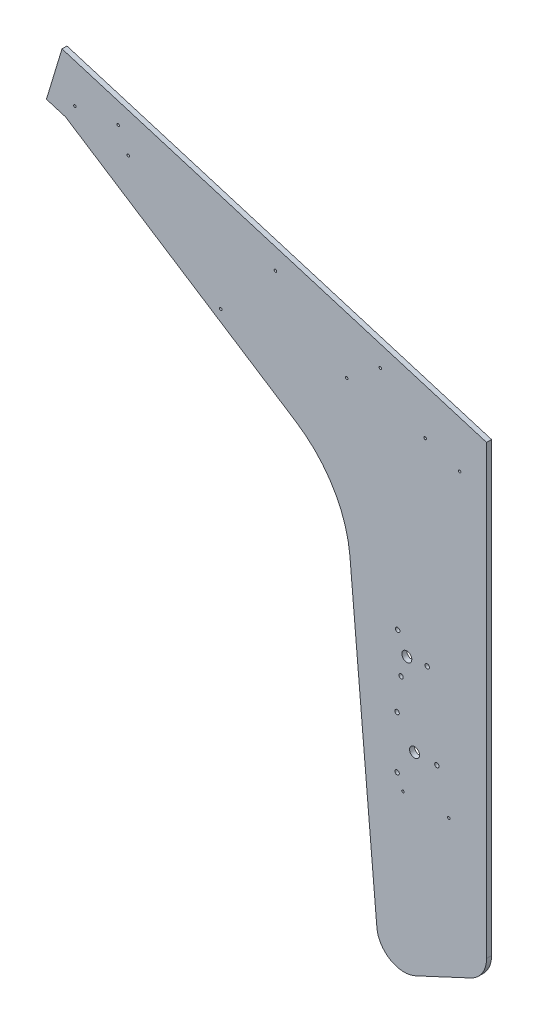
from build123d import *

# Parameters (mm, degrees)
BOSS_EXTRUDE1_DEPTH    = 6.35
F_10_CLEARANCE_HOLE1_D = 5.6134
SKETCH2_R              = 6.35
CUT_EXTRUDE1_DEPTH     = 595.969799783
HOLE1_D                = 3.175
HOLE1_DEPTH            = 31.75
HOLE1_CSINK_D          = 10.16
HOLE1_CSINK_ANGLE      = 82
HOLE1_TIP              = 0.953866233


with BuildPart() as part:
    # Sketch1 → Boss-Extrude1 (new body)
    with BuildSketch(Plane.XY):
        with BuildLine():
            Line((-35.929687435, 42.153790719), (-1.51387348, -351.220762831))
            ThreePointArc((-1.51387348, -351.220762831), (15.815726351, -378.422785743), (48.038169143, -379.829647978))
            Line((48.038169143, -379.829647978), (118.213861049, -347.106185426))
            ThreePointArc((118.213861049, -347.106185426), (132.909364503, -334.218574785), (138.378918258, -315.453385964))
            Line((138.378918258, -315.453385964), (138.378918258, 254.538122714))
            Line((138.378918258, 254.538122714), (-403.099057101, 418.419278389))
            Line((-403.099057101, 418.419278389), (-422.935039487, 352.879420938))
            Line((-422.935039487, 352.879420938), (-398.624090476, 345.521584423))
            Line((-398.624090476, 345.521584423), (-105.026598758, 156.030008008))
            ThreePointArc((-105.026598758, 156.030008008), (-57.378429325, 107.040440177), (-35.929687435, 42.153790719))
        make_face()
    extrude(amount=BOSS_EXTRUDE1_DEPTH)

    # #10 Clearance Hole1 (through all)
    with Locations(Plane(origin=(0, 0, 0), x_dir=(-1, 0, 0), z_dir=(0, 0, -1))):
        with Locations((-24.251683892, -100.351877226), (-24.251683892, -167.026877226), (-75.051683892, -133.689377226), (-29.317369668, -58.274702428), (-25.026257572, -9.227066735), (-62.648775204, -30.647052627)):
            Hole(F_10_CLEARANCE_HOLE1_D / 2)

    # Sketch2 → Cut-Extrude1 (cut, through all)
    with BuildSketch(Plane(origin=(0, 0, 0), x_dir=(-1, 0, 0), z_dir=(0, 0, -1))):
        with Locations((-46.476683892, -133.689377226)):
            Circle(SKETCH2_R)
        with Locations((-36.66056812, -32.920726132)):
            Circle(SKETCH2_R)
    extrude(amount=-CUT_EXTRUDE1_DEPTH, mode=Mode.SUBTRACT)

    # Hole1
    with Locations(Plane(origin=(277.286738577, -215.287141225, 12.7), x_dir=(-0.08995962873759034, 0.9959454127598536, 0), z_dir=(0, 0, 1))):
        with Locations((637.870011036, 553.595098153), (52.960474704, 241.752641108), (47.697836423, 183.489834462), (434.459074831, 134.806234549), (453.103621196, 177.188747915), (478.414399376, 275.292665941), (488.870508314, 435.756794718), (636.071223534, 609.111420407), (609.449424187, 543.22015483), (559.371199386, 359.303721429), (507.038658285, 229.776136946)):
            CounterSinkHole(HOLE1_D / 2, HOLE1_CSINK_D / 2, depth=HOLE1_DEPTH, counter_sink_angle=HOLE1_CSINK_ANGLE)
            with Locations((0, 0, -(HOLE1_DEPTH + HOLE1_TIP / 2))):  # 118° drill point
                Cone(0, HOLE1_D / 2, HOLE1_TIP, mode=Mode.SUBTRACT)


solid = part.part
